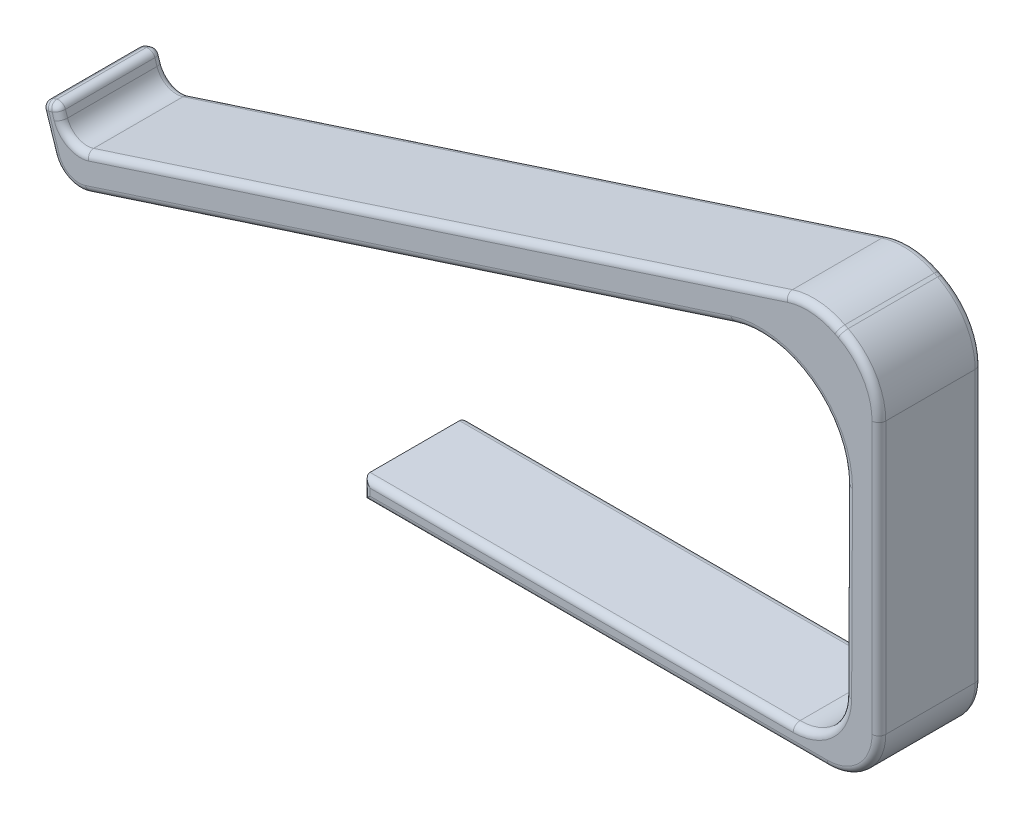
from build123d import *

# Parameters (mm, degrees)
SKETCH2_W           = 250
SKETCH2_H           = 30
BOSS_EXTRUDE1_DEPTH = 10
SKETCH3_W           = 5
SKETCH3_H           = 30
BOSS_EXTRUDE2_DEPTH = 10
SKETCH4_W           = 150
SKETCH4_H           = 30
BOSS_EXTRUDE3_DEPTH = 6
FILLET1_R           = 15
FILLET8_R           = 25
CHAMFER1_SIZE       = 17
FILLET3_R           = 20
FILLET5_R           = 6
FILLET6_R           = 2
FILLET7_R           = 8
SKETCH7_W           = 24
SKETCH7_H           = 24
CUT_EXTRUDE1_DEPTH  = 3


with BuildPart() as part:
    # Sketch2 → Boss-Extrude1 (new body)
    with BuildSketch(Plane(origin=(-23.43534086, 72.126562752, 0), x_dir=(0.9510565162951534, 0.3090169943749482, 0), z_dir=(-0.3090169943749481, 0.9510565162951533, 0))):
        with Locations((33.98053096, 100)):
            Rectangle(SKETCH2_W, SKETCH2_H)
    extrude(amount=-BOSS_EXTRUDE1_DEPTH)

    # Sketch3 → Boss-Extrude2 (add)
    with BuildSketch(Plane(origin=(-23.43534086, 72.126562752, 0), x_dir=(0.9510565162951534, 0.3090169943749482, 0), z_dir=(-0.3090169943749481, 0.9510565162951533, 0))):
        with Locations((-88.51946904, 100)):
            Rectangle(SKETCH3_W, SKETCH3_H)
    extrude(amount=BOSS_EXTRUDE2_DEPTH)



with BuildPart() as body_2:
    # Sketch4 → Boss-Extrude3 (new body)
    with BuildSketch(Plane(origin=(0, 0, 0), x_dir=(1, 0, 0), z_dir=(0, 1, 0))):
        with Locations((55.854299018, 100)):
            Rectangle(SKETCH4_W, SKETCH4_H)
    extrude(amount=BOSS_EXTRUDE3_DEPTH)


with BuildPart() as part_1:
    add(part.part)

    add(body_2.part)  # Loft1 merges body 2
    # Sketch6 → Loft1 section 0
    with BuildSketch(Plane(origin=(-20.345170916, 62.615997589, 0), x_dir=(0.9510565162951534, 0.3090169943749482, 0), z_dir=(0.3090169943749481, -0.9510565162951533, 0))):
        with BuildLine():
            Line((158.98053096, -85), (148.98053096, -85))
            Line((148.98053096, -85), (148.98053096, -115))
            Line((148.98053096, -115), (158.98053096, -115))
            Line((158.98053096, -115), (158.98053096, -85))
        make_face()
    # Sketch5 → Loft1 section 1
    with BuildSketch(Plane(origin=(0, 6, 0), x_dir=(1, 0, 0), z_dir=(0, 1, 0))):
        with BuildLine():
            Line((130.854299018, 115), (120.854299018, 115))
            Line((120.854299018, 115), (120.854299018, 85))
            Line((120.854299018, 85), (130.854299018, 85))
            Line((130.854299018, 85), (130.854299018, 115))
        make_face()
    loft()

    # Fillet1
    fillet1_edges = [part_1.edges().sort_by_distance(p)[0] for p in [
        (130.854299018, 0, -100),
        (120.854299018, 6, -100),
    ]]
    fillet(fillet1_edges, radius=FILLET1_R)

    # Fillet8
    fillet8_edges = [part_1.edges().sort_by_distance(p)[0] for p in [
        (121.343733855, 108.653513487, -100),
    ]]
    fillet(fillet8_edges, radius=FILLET8_R)

    # Chamfer1
    # the kernel refuses this chamfer: 17 mm, written as the material it takes off along each edge
    with BuildSketch(Plane(origin=(127.764129074, 121.254248594, -41.281389205), x_dir=(-0.9591936310578489, -0.28275002765350715, 0), z_dir=(0, 0, -1))) as chamfer1_piece_1:
        Polygon((CHAMFER1_SIZE * 0.999621916911, -CHAMFER1_SIZE * 0.0274958766106), (-CHAMFER1_SIZE * 0.0274958766106, -CHAMFER1_SIZE * 0.999621916911), (0, 0), align=None)
    extrude(amount=117.437221591, mode=Mode.SUBTRACT)

    # Fillet3
    fillet3_edges = [part_1.edges().sort_by_distance(p)[0] for p in [
        (130.854299018, 106.188451977, -100),
        (111.596168297, 116.000959689, -100),
    ]]
    fillet(fillet3_edges, radius=FILLET3_R)

    # Fillet5
    fillet5_edges = [part_1.edges().sort_by_distance(p)[0] for p in [
        (-105.244717419, 45.545084972, -100),
    ]]
    fillet(fillet5_edges, radius=FILLET5_R)

    # Fillet6
    fillet6_edges = [part_1.edges().sort_by_distance(p)[0] for p in [
        (2.089489912, 80.420083013, -115),
        (-104.116423285, 47.759486891, -115),
        (-104.116423285, 47.759486891, -85),
        (-107.716853374, 53.153537102, -85),
        (-107.716853374, 53.153537102, -115),
        (-113.090169944, 53.510565163, -100),
        (-9.228059595, 66.228166023, -115),
        (-110.712528653, 54.283107649, -85),
        (-108.334887362, 55.055650135, -100),
        (-110.712528653, 54.283107649, -115),
        (43.389972522, 6, -85),
        (-19.145700982, 3, -115),
        (48.354299018, 0, -85),
        (-19.145700982, 3, -85),
        (43.389972522, 6, -115),
        (48.354299018, 0, -115),
        (126.460900735, 4.393398282, -115),
        (126.460900735, 4.393398282, -85),
        (116.506932566, 10.368143382, -85),
        (116.506932566, 10.368143382, -115),
        (121.052163557, 47.499886569, -115),
        (121.052163557, 47.499886569, -85),
        (-9.228059595, 66.228166023, -85),
        (110.921940595, 94.380821213, -115),
        (110.921940595, 94.380821213, -85),
        (-110, 44, -115),
        (-110, 44, -85),
        (130.854299018, 54.466218107, -115),
        (130.854299018, 54.466218107, -85),
        (119.455808519, 111.996272972, -85),
        (2.089489912, 80.420083013, -85),
        (111.466879946, 114.358195437, -85),
        (127.907102305, 104.382407509, -85),
        (119.455808519, 111.996272972, -115),
        (111.466879946, 114.358195437, -115),
        (127.907102305, 104.382407509, -115),
    ]]
    fillet(fillet6_edges, radius=FILLET6_R)

    # Fillet7
    # the kernel refuses this fillet: 8 mm, written as the material it takes off along each edge
    with BuildSketch(Plane(origin=(-101.773513881, 44.570022922, -85), x_dir=(-0.9510565162951534, -0.3090169943749482, 0), z_dir=(-0.3090169943749482, 0.9510565162951534, 0))) as fillet7_piece_1:
        with BuildLine():
            CenterArc((6, -2), 2, 0, 90)
            Line((8, -2), (8, 0))
            Line((8, 0), (6, 0))
        make_face()
    revolve(axis=Axis((-101.773513881, 44.570022922, -85), (0, 0, 1)), revolution_arc=90, mode=Mode.SUBTRACT)
    with BuildSketch(Plane(origin=(-101.773513881, 44.570022922, -115), x_dir=(0.3090169943749482, -0.9510565162951534, 0), z_dir=(0.9510565162951534, 0.3090169943749482, 0))) as fillet7_piece_2:
        with BuildLine():
            CenterArc((6, -2), 2, 0, 90)
            Line((8, -2), (8, 0))
            Line((8, 0), (6, 0))
        make_face()
    revolve(axis=Axis((-101.773513881, 44.570022922, -115), (0, 0, -1)), revolution_arc=90, mode=Mode.SUBTRACT)
    with BuildSketch(Plane(origin=(-106.909830056, 34.489434837, -115), x_dir=(0.9510565162951533, 0.3090169943749485, 0), z_dir=(0, 0, 1))) as fillet7_piece_3:
        with BuildLine():
            CenterArc((FILLET7_R, FILLET7_R), FILLET7_R, 180, 90)
            Line((0, FILLET7_R), (0, 0))
            Line((0, 0), (FILLET7_R, 0))
        make_face()
    extrude(amount=30, mode=Mode.SUBTRACT)

    # Sketch7 → Cut-Extrude1 (cut)
    with BuildSketch(Plane.XZ):
        with Locations((-13.956396798, -100)):
            Rectangle(SKETCH7_W, SKETCH7_H)
    extrude(amount=-CUT_EXTRUDE1_DEPTH, mode=Mode.SUBTRACT)


solid = part_1.part
